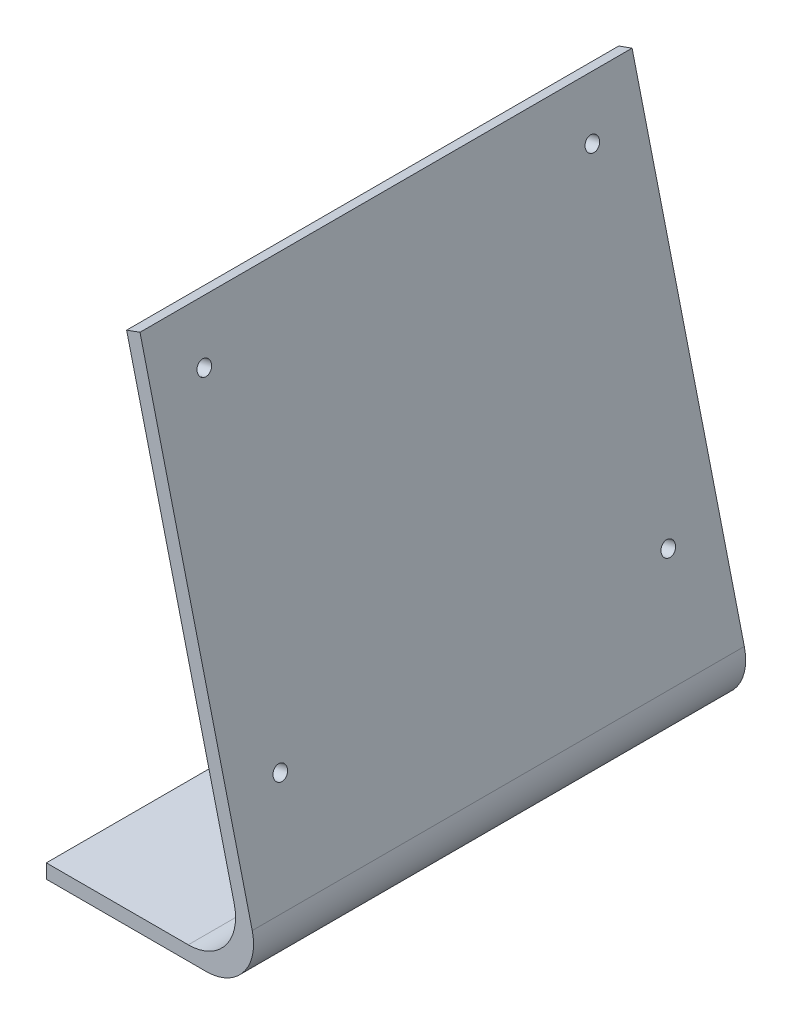
from build123d import *

# Parameters (mm, degrees)
BOSS_EXTRUDE1_DEPTH = 52
CUT_EXTRUDE_1_REACH = 133.119
SKETCH_2_R          = 1.5


with BuildPart() as part:
    # Sketch1 → Boss-Extrude1 (new, symmetric)
    with BuildSketch(Plane.XY):
        with BuildLine():
            Line((-50.530004832, 0), (-50.530004832, 3))
            Line((-50.530004832, 3), (-20.530004832, 3))
            ThreePointArc((-20.530004832, 3), (-12.668388321, 6.819790793), (-10.812717884, 15.361002831))
            Line((-10.812717884, 15.361002831), (-33.559523327, 108.981066609))
            Line((-33.559523327, 108.981066609), (-30.737861628, 110))
            Line((-30.737861628, 110), (-7.014578577, 12.361002831))
            ThreePointArc((-7.014578577, 12.361002831), (-8.870249014, 3.819790793), (-16.731865525, 0))
            Line((-16.731865525, 0), (-50.530004832, 0))
        make_face()
    extrude(amount=BOSS_EXTRUDE1_DEPTH, both=True)

    # Эскиз2 → Вырез-Вытянуть1 (cut, up to next)
    with BuildSketch(Plane(origin=(-3.787634246, -0.920279007, 0), x_dir=(0, 0, -1), z_dir=(0.9717286948053454, 0.23610028312541273, 0)), mode=Mode.PRIVATE) as cut_extrude_1_sk1:
        with Locations((-41, 103.147374262)):
            Circle(SKETCH_2_R)
    cut_extrude_1_tool1 = extrude(cut_extrude_1_sk1.sketch, amount=-CUT_EXTRUDE_1_REACH, mode=Mode.PRIVATE) & part.part
    # Эскиз2 → Вырез-Вытянуть1 (cut, up to next)
    with BuildSketch(Plane(origin=(-3.787634246, -0.920279007, 0), x_dir=(0, 0, -1), z_dir=(0.9717286948053454, 0.23610028312541273, 0)), mode=Mode.PRIVATE) as cut_extrude_1_sk2:
        with Locations((41, 103.147374262)):
            Circle(SKETCH_2_R)
    cut_extrude_1_tool2 = extrude(cut_extrude_1_sk2.sketch, amount=-CUT_EXTRUDE_1_REACH, mode=Mode.PRIVATE) & part.part
    # Эскиз2 → Вырез-Вытянуть1 (cut, up to next)
    with BuildSketch(Plane(origin=(-3.787634246, -0.920279007, 0), x_dir=(0, 0, -1), z_dir=(0.9717286948053454, 0.23610028312541273, 0)), mode=Mode.PRIVATE) as cut_extrude_1_sk3:
        with Locations((41, 35.147374262)):
            Circle(SKETCH_2_R)
    cut_extrude_1_tool3 = extrude(cut_extrude_1_sk3.sketch, amount=-CUT_EXTRUDE_1_REACH, mode=Mode.PRIVATE) & part.part
    # Эскиз2 → Вырез-Вытянуть1 (cut, up to next)
    with BuildSketch(Plane(origin=(-3.787634246, -0.920279007, 0), x_dir=(0, 0, -1), z_dir=(0.9717286948053454, 0.23610028312541273, 0)), mode=Mode.PRIVATE) as cut_extrude_1_sk4:
        with Locations((-41, 35.147374262)):
            Circle(SKETCH_2_R)
    cut_extrude_1_tool4 = extrude(cut_extrude_1_sk4.sketch, amount=-CUT_EXTRUDE_1_REACH, mode=Mode.PRIVATE) & part.part
    add(cut_extrude_1_tool1.solids().sort_by_distance((-28.140759, 99.310984, 41))[0], mode=Mode.SUBTRACT)
    add(cut_extrude_1_tool2.solids().sort_by_distance((-28.140759, 99.310984, -41))[0], mode=Mode.SUBTRACT)
    add(cut_extrude_1_tool3.solids().sort_by_distance((-12.085939, 33.233433, -41))[0], mode=Mode.SUBTRACT)
    add(cut_extrude_1_tool4.solids().sort_by_distance((-12.085939, 33.233433, 41))[0], mode=Mode.SUBTRACT)


solid = part.part
